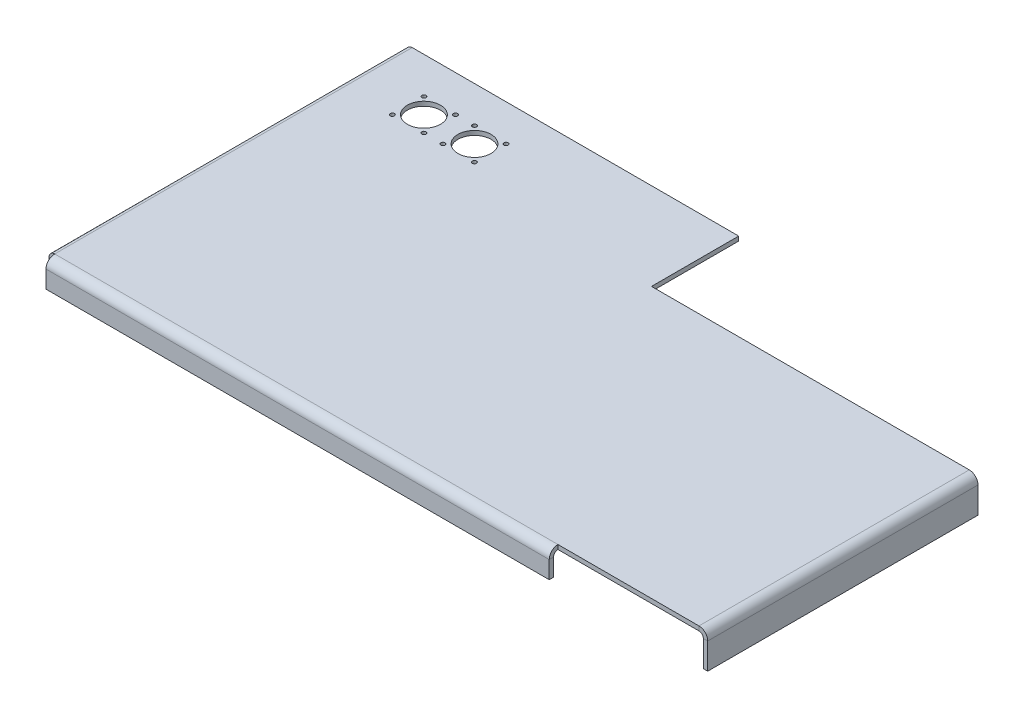
from build123d import *

# Parameters (mm, degrees)
SKETCH5_W                    = 475.54896
SKETCH5_H                    = 260.35
BASE_FLANGE1_DEPTH           = 3.175
EDGE_FLANGE1_DEPTH           = 366.48136
EDGE_FLANGE2_STRIP_W         = 19.05
EDGE_FLANGE2_STRIP_H         = 3.175
EDGE_FLANGE2_STRIP_CUT_DEPTH = 260.35
EDGE_FLANGE2_DEPTH           = 260.35
EDGE_FLANGE3_DEPTH           = 260.35
CUT_EXTRUDE1_DEPTH           = 279.969149723
CUT_EXTRUDE1_DEPTH_BACK      = 279.969149723
SKETCH15_W                   = 329.647515686
SKETCH15_H                   = 175.541944057
CUT_EXTRUDE2_DEPTH           = 279.698003441
CUT_EXTRUDE2_DEPTH_BACK      = 279.698003441
SKETCH16_R                   = 12.065
SKETCH16_R_2                 = 1.524


# Sheet-metal steps are written as plain solids
with BuildPart() as part:
    # Sketch5 → Base-Flange1 (new body)
    with BuildSketch(Plane(origin=(0, 0, 0), x_dir=(1, 0, 0), z_dir=(0, 1, 0))):
        Rectangle(SKETCH5_W, SKETCH5_H)
    extrude(amount=-BASE_FLANGE1_DEPTH)

    # Edge-Flange1 section (across the edge) → Edge-Flange1 (add)
    with BuildSketch(Plane(origin=(128.70688, -3.175, 133.35), x_dir=(0, 0, -1), z_dir=(-1, 0, 0))):
        with BuildLine():
            Line((-3.175, 3.175), (-3.175, 15.875))
            Line((-3.175, 15.875), (0, 15.875))
            Line((0, 15.875), (0, 3.175))
            ThreePointArc((0, 3.175), (0.92993597, 0.92993597), (3.175, 0))
            Line((3.175, 0), (3.175, -3.175))
            ThreePointArc((3.175, -3.175), (-1.315128061, -1.315128061), (-3.175, 3.175))
        make_face()
    extrude(amount=EDGE_FLANGE1_DEPTH)

    # Edge-Flange2 strip (across the edge) → Edge-Flange2 strip cut (cut)
    with BuildSketch(Plane(origin=(237.77448, -3.175, -130.175), x_dir=(-1, 0, 0), z_dir=(0, 0, 1))):
        with Locations((-3.175, -1.5875)):
            Rectangle(EDGE_FLANGE2_STRIP_W, EDGE_FLANGE2_STRIP_H)
    extrude(amount=EDGE_FLANGE2_STRIP_CUT_DEPTH, mode=Mode.SUBTRACT)

    # Edge-Flange2 section (across the edge) → Edge-Flange2 (add)
    with BuildSketch(Plane(origin=(237.77448, -3.175, -130.175), x_dir=(-1, 0, 0), z_dir=(0, 0, 1))):
        with BuildLine():
            Line((0, 3.175), (0, 22.225))
            Line((0, 22.225), (3.175, 22.225))
            Line((3.175, 22.225), (3.175, 3.175))
            ThreePointArc((3.175, 3.175), (4.10493597, 0.92993597), (6.35, 0))
            Line((6.35, 0), (6.35, -3.175))
            ThreePointArc((6.35, -3.175), (1.859871939, -1.315128061), (0, 3.175))
        make_face()
    extrude(amount=EDGE_FLANGE2_DEPTH)

    # Edge-Flange3 section (across the edge) → Edge-Flange3 (add)
    with BuildSketch(Plane(origin=(-238.77448, -3.175, 130.175), x_dir=(1, 0, 0), z_dir=(0, 0, -1))):
        with BuildLine():
            Line((-3.175, 1), (-3.175, 22.225))
            Line((-3.175, 22.225), (0, 22.225))
            Line((0, 22.225), (0, 1))
            ThreePointArc((0, 1), (0.292893219, 0.292893219), (1, 0))
            Line((1, 0), (1, -3.175))
            ThreePointArc((1, -3.175), (-1.952170811, -1.952170811), (-3.175, 1))
        make_face()
    extrude(amount=EDGE_FLANGE3_DEPTH)

    # Sketch15 → Cut-Extrude1 (cut, two sides: drawn at the far end of the back side and taken through both)
    with BuildSketch(Plane(origin=(0, 0, 0), x_dir=(1, 0, 0), z_dir=(0, 1, 0)).offset(-CUT_EXTRUDE1_DEPTH_BACK)):
        with Locations((164.823757843, 154.445972028)):
            Rectangle(SKETCH15_W, SKETCH15_H)
    extrude(amount=CUT_EXTRUDE1_DEPTH + CUT_EXTRUDE1_DEPTH_BACK, mode=Mode.SUBTRACT)

    # Sketch16 → Cut-Extrude2 (cut, two sides: drawn at the far end of the back side and taken through both)
    with BuildSketch(Plane.XZ.offset(3.175).offset(-CUT_EXTRUDE2_DEPTH_BACK)):
        with Locations(Location((-191.14948, -92.075, 0), (0, 0, 270))):
            Circle(SKETCH16_R)
        with Locations(Location((-179.654811625, -80.580212705, 0), (0, 0, 270))):
            Circle(SKETCH16_R_2)
        with Locations(Location((-202.644148375, -80.580212705, 0), (0, 0, 270))):
            Circle(SKETCH16_R_2)
        with Locations(Location((-179.654811625, -103.569787295, 0), (0, 0, 90))):
            Circle(SKETCH16_R_2)
        with Locations(Location((-202.644148375, -103.569787295, 0), (0, 0, 90))):
            Circle(SKETCH16_R_2)
        with Locations(Location((-165.814148375, -80.580212705, 0), (0, 0, 270))):
            Circle(SKETCH16_R_2)
        with Locations(Location((-154.31948, -92.075, 0), (0, 0, 270))):
            Circle(SKETCH16_R)
        with Locations(Location((-142.824811625, -80.580212705, 0), (0, 0, 270))):
            Circle(SKETCH16_R_2)
        with Locations(Location((-165.814148375, -103.569787295, 0), (0, 0, 90))):
            Circle(SKETCH16_R_2)
        with Locations(Location((-142.824811625, -103.569787295, 0), (0, 0, 90))):
            Circle(SKETCH16_R_2)
    extrude(amount=CUT_EXTRUDE2_DEPTH + CUT_EXTRUDE2_DEPTH_BACK, mode=Mode.SUBTRACT)


solid = part.part
